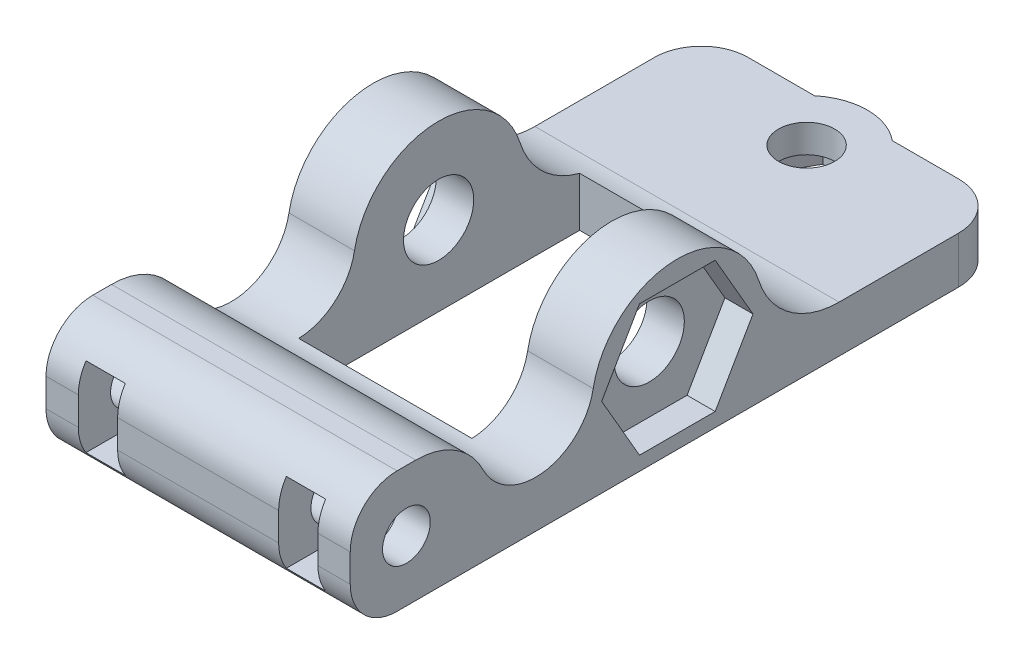
from build123d import *

# Parameters (mm, degrees)
SKETCH1_R           = 3
SKETCH1_W           = 18.5
SKETCH1_H           = 30
BOSS_EXTRUDE1_DEPTH = 18.28
SKETCH2_R           = 3.75
SKETCH2_R_2         = 2.55
CUT_EXTRUDE1_DEPTH  = 81.639062495
CUT_EXTRUDE2_DEPTH  = 3
SKETCH4_W           = 4.2
SKETCH4_H           = 8.5
CUT_EXTRUDE3_DEPTH  = 11.67582
CUT_EXTRUDE4_DEPTH  = 2


with BuildPart() as part:
    # Sketch1 → Boss-Extrude1 (new body)
    with BuildSketch(Plane(origin=(0, 0, 0), x_dir=(1, 0, 0), z_dir=(0, 1, 0))):
        with BuildLine():
            Line((0, 0), (32.5, 0))
            Line((32.5, 0), (32.5, 65))
            ThreePointArc((32.5, 65), (31.035533906, 68.535533906), (27.5, 70))
            Line((27.5, 70), (20.403311931, 70))
            ThreePointArc((20.403311931, 70), (16.25, 71.5), (12.096688069, 70))
            Line((12.096688069, 70), (5, 70))
            ThreePointArc((5, 70), (1.464466094, 68.535533906), (0, 65))
            Line((0, 65), (0, 0))
        make_face()
        with Locations((16.25, 65)):
            Circle(SKETCH1_R, mode=Mode.SUBTRACT)
        with Locations((16.25, 35)):
            Rectangle(SKETCH1_W, SKETCH1_H, mode=Mode.SUBTRACT)
    extrude(amount=BOSS_EXTRUDE1_DEPTH)

    # Sketch2 → Cut-Extrude1 (cut, through all)
    with BuildSketch(Plane.ZY):
        with BuildLine():
            Line((-71.5, 18.28), (-71.5, 5))
            Line((-71.5, 5), (-52.220306773, 5))
            ThreePointArc((-52.220306773, 5), (-46.908361498, 6.734792681), (-43.644221508, 11.270391691))
            ThreePointArc((-43.644221508, 11.270391691), (-34.353354824, 17.615612411), (-25.952469379, 10.131819693))
            ThreePointArc((-25.952469379, 10.131819693), (-20.659340597, 5.058687621), (-14.189782649, 8.508137035))
            ThreePointArc((-14.189782649, 8.508137035), (-11.238803116, 11.78472904), (-7, 13))
            Line((-7, 13), (-5, 13))
            ThreePointArc((-5, 13), (-1.464466094, 11.535533906), (0, 8))
            Line((0, 8), (0, 18.28))
            Line((0, 18.28), (-71.5, 18.28))
        make_face()
        with BuildLine():
            ThreePointArc((0, 5), (-1.464466094, 1.464466094), (-5, 0))
            Line((-5, 0), (0, 0))
            Line((0, 0), (0, 5))
        make_face()
        with Locations((-34.94, 8.5)):
            Circle(SKETCH2_R)
        with Locations((-6, 6.5)):
            Circle(SKETCH2_R_2)
    extrude(amount=-CUT_EXTRUDE1_DEPTH, mode=Mode.SUBTRACT)

    # Sketch3 → Cut-Extrude2 (cut)
    with BuildSketch(Plane.ZY):
        Polygon((-26.857096231, 8.5), (-30.898548116, 15.5), (-38.981451884, 15.5), (-43.022903769, 8.5), (-38.981451884, 1.5), (-30.898548116, 1.5), align=None)
    cut_extrude2 = extrude(amount=-CUT_EXTRUDE2_DEPTH, mode=Mode.SUBTRACT)

    # Mirror1: Cut-Extrude2 across plane
    add(cut_extrude2.mirror(Plane.ZY.offset(-16.25)), mode=Mode.SUBTRACT)

    # Sketch4 → Cut-Extrude3 (cut)
    with BuildSketch(Plane.XY):
        with Locations((5.55, 6.5)):
            Rectangle(SKETCH4_W, SKETCH4_H)
    cut_extrude3 = extrude(amount=-CUT_EXTRUDE3_DEPTH, mode=Mode.SUBTRACT)

    # Mirror2: Cut-Extrude3 across plane
    add(cut_extrude3.mirror(Plane.ZY.offset(-16.25)), mode=Mode.SUBTRACT)

    # Sketch5 → Cut-Extrude4 (cut)
    with BuildSketch(Plane.XZ):
        Polygon((11.515727793, -65), (13.882863896, -69.1), (18.617136104, -69.1), (20.984272207, -65), (18.617136104, -60.9), (13.882863896, -60.9), align=None)
    extrude(amount=-CUT_EXTRUDE4_DEPTH, mode=Mode.SUBTRACT)


solid = part.part
